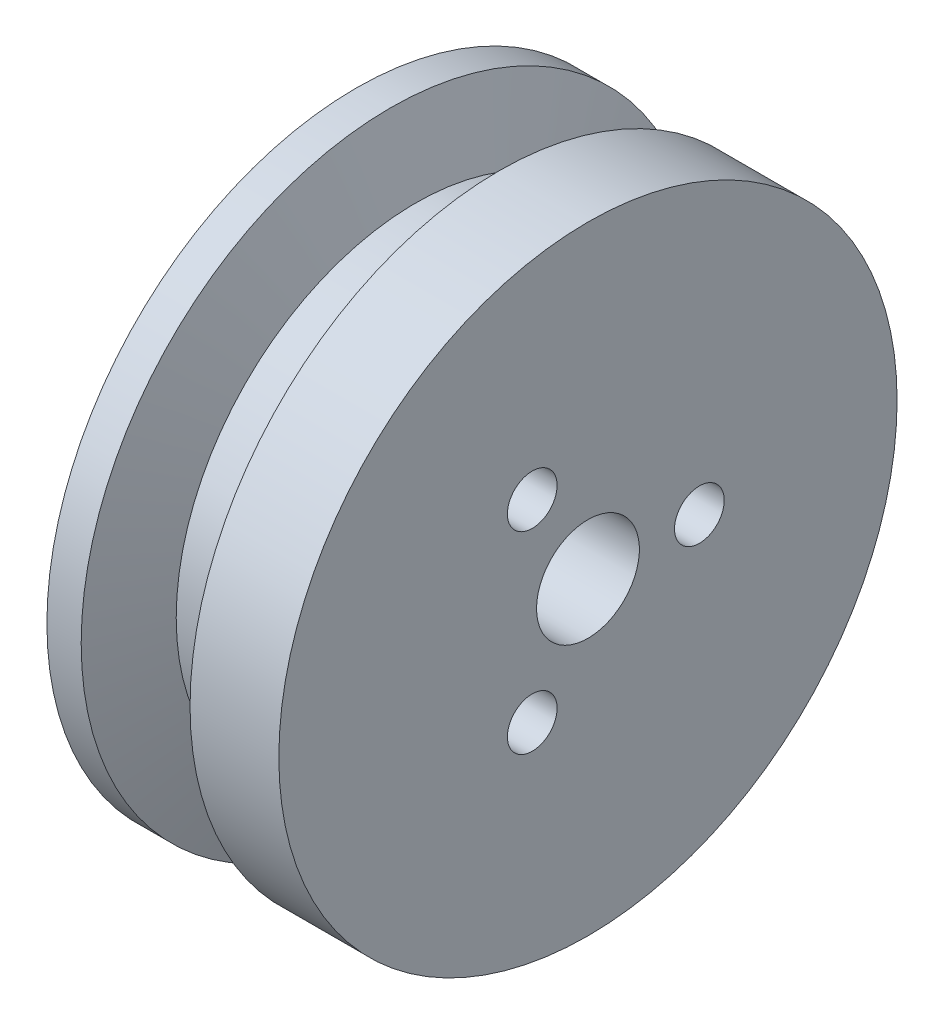
from build123d import *

# Parameters (mm, degrees)
CBORE_FOR_M2_5_SHCS1_D           = 2.9
CBORE_FOR_M2_5_SHCS1_CBORE_D     = 5.5
CBORE_FOR_M2_5_SHCS1_CBORE_DEPTH = 9
F_10_32_TAPPED_HOLE1_D           = 4.0386


with BuildPart() as part:
    # Sketch1 → Revolve1 (revolve)
    with BuildSketch(Plane.XY):
        Polygon((0, 0), (0, 18.034), (2, 18.034), (3.479175032, 13.97), (6.870824968, 13.97), (8.35, 18.034), (13.53, 18.034), (13.53, 3), (8.53, 3), (8.53, 0), align=None)
    revolve(axis=Axis((0, 0, 0), (1, 0, 0)))

    # CBORE for M2.5 SHCS1 (through all)
    with Locations(Plane.ZY):
        with Locations((-6.5, 0), (3.25, 5.629165125), (3.25, -5.629165125)):
            CounterBoreHole(CBORE_FOR_M2_5_SHCS1_D / 2, CBORE_FOR_M2_5_SHCS1_CBORE_D / 2, CBORE_FOR_M2_5_SHCS1_CBORE_DEPTH)

    # #10-32 Tapped Hole1 (through all)
    with Locations(Plane.ZY):
        with Locations((0, 0)):
            Hole(F_10_32_TAPPED_HOLE1_D / 2)


solid = part.part
